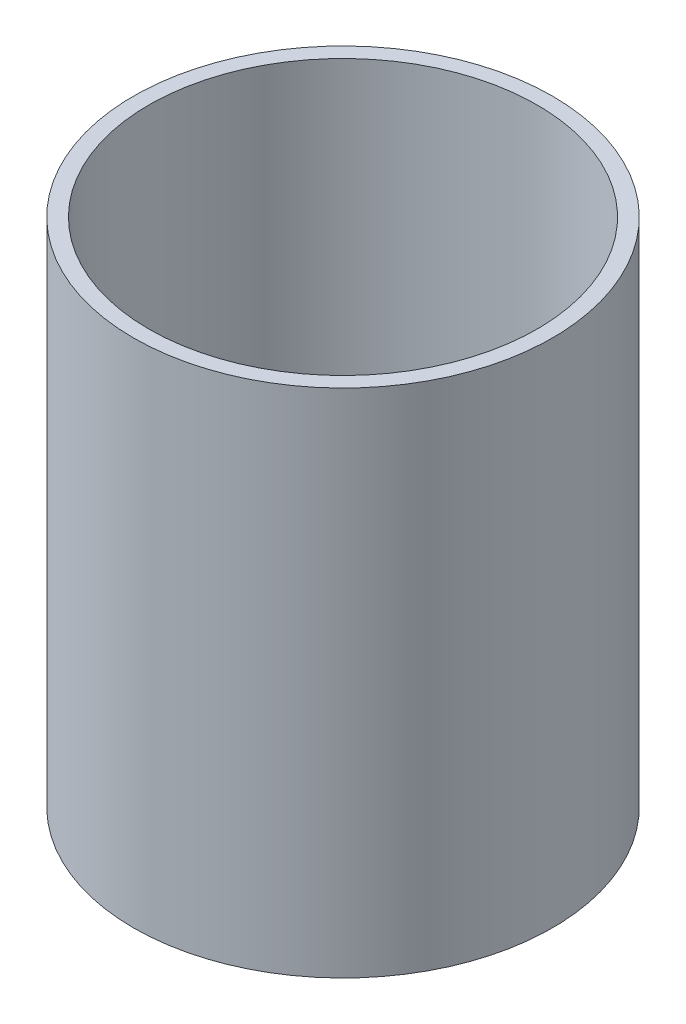
from build123d import *

# Parameters (mm, degrees)
SKETCH1_R           = 20.5
SKETCH1_R_2         = 19
BOSS_EXTRUDE1_DEPTH = 50


with BuildPart() as part:
    # Sketch1 → Boss-Extrude1 (new body)
    with BuildSketch(Plane(origin=(0, 0, 0), x_dir=(1, 0, 0), z_dir=(0, 1, 0))):
        Circle(SKETCH1_R)
        Circle(SKETCH1_R_2, mode=Mode.SUBTRACT)
    extrude(amount=BOSS_EXTRUDE1_DEPTH)


solid = part.part
